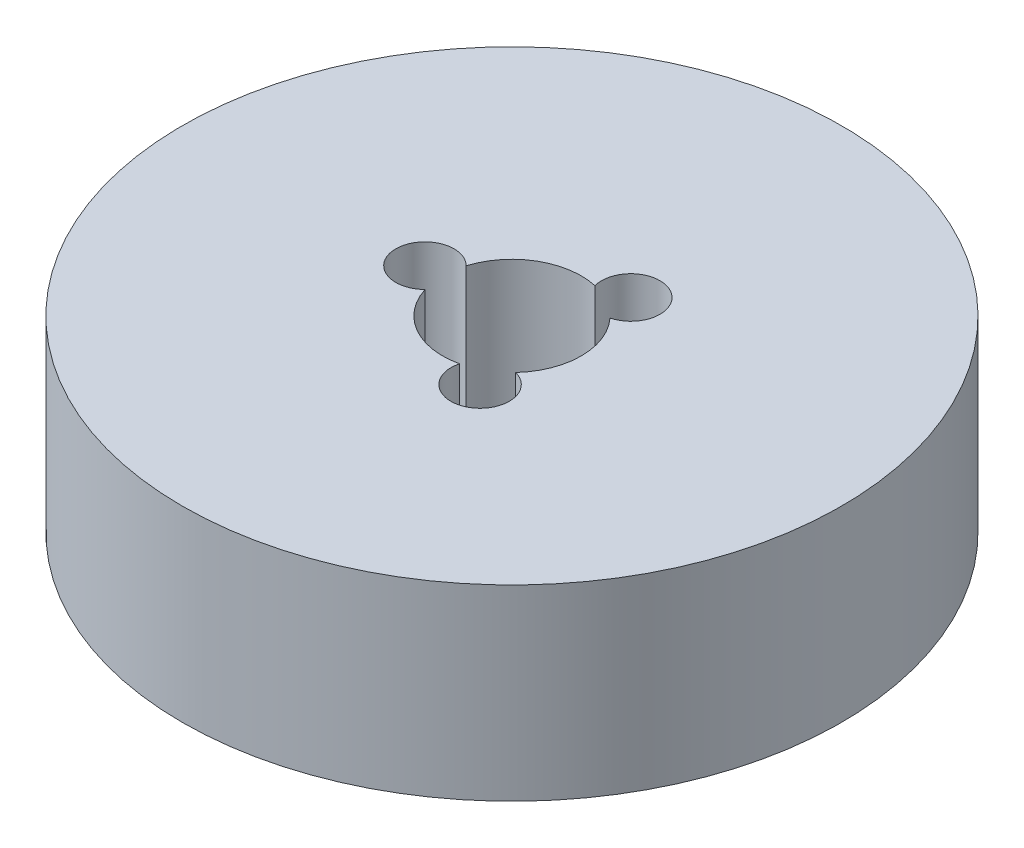
from build123d import *

# Parameters (mm, degrees)
SKETCH1_R           = 47.5
BOSS_EXTRUDE1_DEPTH = 27
SKETCH2_R           = 10
CUT_EXTRUDE1_DEPTH  = 73.398204398
SKETCH3_R           = 4.203936478
CUT_EXTRUDE2_DEPTH  = 20.668056153
CIRPATTERN1_COUNT   = 3


with BuildPart() as part:
    # Sketch1 → Boss-Extrude1 (new body)
    with BuildSketch(Plane(origin=(0, 0, 0), x_dir=(1, 0, 0), z_dir=(0, 1, 0))):
        Circle(SKETCH1_R)
    extrude(amount=BOSS_EXTRUDE1_DEPTH)

    # Sketch2 → Cut-Extrude1 (cut, through all)
    with BuildSketch(Plane(origin=(0, 0, 0), x_dir=(1, 0, 0), z_dir=(0, 1, 0))):
        Circle(SKETCH2_R)
    extrude(amount=CUT_EXTRUDE1_DEPTH, mode=Mode.SUBTRACT)

    # Sketch3 → Cut-Extrude2 (cut)
    with BuildSketch(Plane(origin=(0, 27, 0), x_dir=(1, 0, 0), z_dir=(0, 1, 0))):
        with Locations((-12.5410152, 0)):
            Circle(SKETCH3_R)
    cut_extrude2 = extrude(amount=-CUT_EXTRUDE2_DEPTH, mode=Mode.SUBTRACT)

    # CirPattern1: Cut-Extrude2 ×3 about axis
    cirpattern1_axis = Axis((0, 0, 0), (0, 1, 0))
    for i in range(1, CIRPATTERN1_COUNT):
        add(cut_extrude2.rotate(cirpattern1_axis, i * 360 / CIRPATTERN1_COUNT), mode=Mode.SUBTRACT)


solid = part.part
